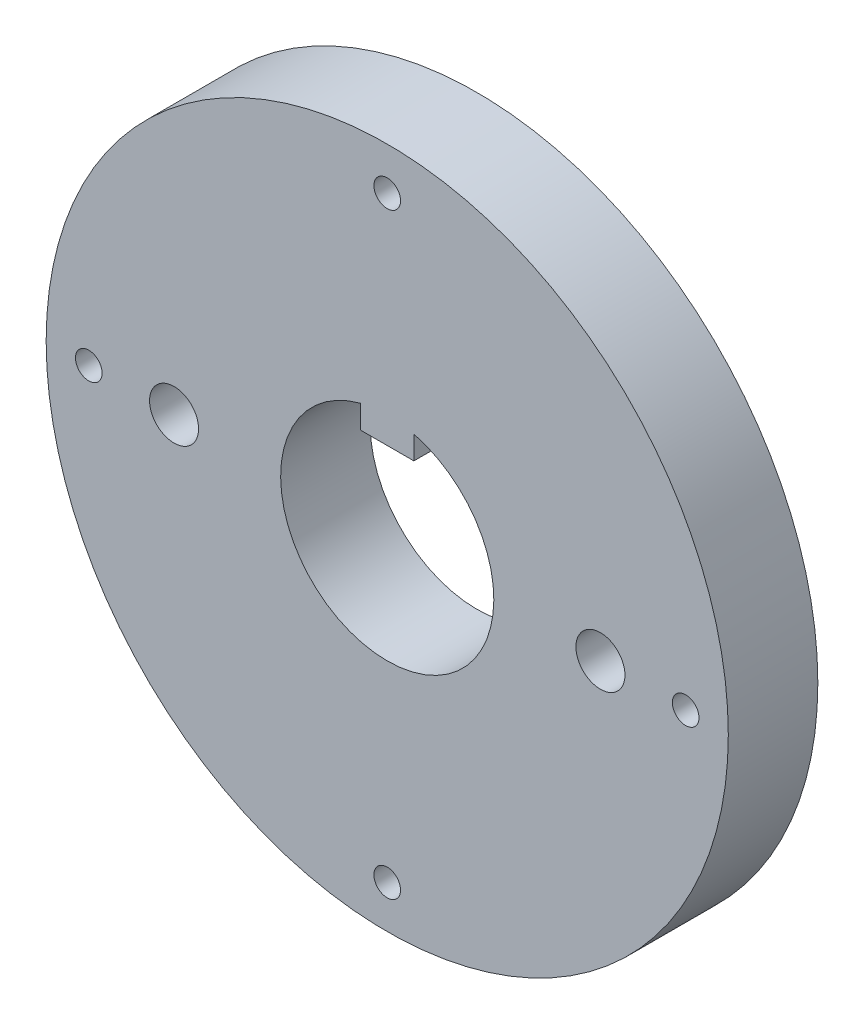
from build123d import *

# Parameters (mm, degrees)
SKETCH1_R                       = 20.32
SKETCH1_R_2                     = 9.144
BOSS_EXTRUDE1_DEPTH             = 2.667
SKETCH2_R                       = 1.4605
CUT_EXTRUDE1_DEPTH              = 30.227664224
BOSS_EXTRUDE2_REACH             = 30.86
SKETCH3_R                       = 9.525
BOSS_EXTRUDE2_DIRECTION_2_REACH = 30.86
SKETCH4_R                       = 0.79375
CUT_EXTRUDE2_DEPTH              = 30.227664224


with BuildPart() as part:
    # Sketch1 → Boss-Extrude1 (new, symmetric)
    with BuildSketch(Plane.XY):
        Circle(SKETCH1_R)
        Circle(SKETCH1_R_2, mode=Mode.SUBTRACT)
    extrude(amount=BOSS_EXTRUDE1_DEPTH, both=True)

    # Sketch2 → Cut-Extrude1 (cut, through all)
    with BuildSketch(Plane.XY.offset(2.667)):
        with Locations((12.7, 0)):
            Circle(SKETCH2_R)
        with Locations((-12.7, 0)):
            Circle(SKETCH2_R)
    extrude(amount=-CUT_EXTRUDE1_DEPTH, mode=Mode.SUBTRACT)

    # Boss-Extrude2: up to this face of the body (flat: up to its plane)
    boss_extrude2_end = Plane(part.part.faces().sort_by_distance((-19.745263608, 0, 2.667))[0])
    # Sketch3 → Boss-Extrude2 (add, up to the picked face)
    with BuildSketch(Plane.XY, mode=Mode.PRIVATE) as boss_extrude2_sk1:
        Circle(SKETCH3_R)
        with BuildLine():
            Line((-1.5875, 6.148361062), (-1.5875, 4.7625))
            Line((-1.5875, 4.7625), (1.5875, 4.7625))
            Line((1.5875, 4.7625), (1.5875, 6.148361062))
            ThreePointArc((1.5875, 6.148361062), (0, -6.35), (-1.5875, 6.148361062))
        make_face(mode=Mode.SUBTRACT)
    boss_extrude2_tool1 = split(extrude(boss_extrude2_sk1.sketch, amount=BOSS_EXTRUDE2_REACH, mode=Mode.PRIVATE), bisect_by=boss_extrude2_end, keep=Keep.BOTH, mode=Mode.PRIVATE)
    add(boss_extrude2_tool1.solids().sort_by(Axis((-9.255592, 0, 0), (0, 0, 1)))[0])

    # Boss-Extrude2 direction 2: up to this face of the body (flat: up to its plane)
    boss_extrude2_direction_2_end = Plane(part.part.faces().sort_by_distance((-19.745263608, 0, -2.667))[0])
    # Sketch3 → Boss-Extrude2 direction 2 (add, up to the picked face)
    with BuildSketch(Plane.XY, mode=Mode.PRIVATE) as boss_extrude2_direction_2_sk1:
        Circle(SKETCH3_R)
        with BuildLine():
            Line((-1.5875, 6.148361062), (-1.5875, 4.7625))
            Line((-1.5875, 4.7625), (1.5875, 4.7625))
            Line((1.5875, 4.7625), (1.5875, 6.148361062))
            ThreePointArc((1.5875, 6.148361062), (0, -6.35), (-1.5875, 6.148361062))
        make_face(mode=Mode.SUBTRACT)
    boss_extrude2_direction_2_tool1 = split(extrude(boss_extrude2_direction_2_sk1.sketch, amount=-BOSS_EXTRUDE2_DIRECTION_2_REACH, mode=Mode.PRIVATE), bisect_by=boss_extrude2_direction_2_end, keep=Keep.BOTH, mode=Mode.PRIVATE)
    add(boss_extrude2_direction_2_tool1.solids().sort_by(Axis((-9.255592, 0, 0), (0, 0, -1)))[0])

    # Sketch4 → Cut-Extrude2 (cut, through all)
    with BuildSketch(Plane.XY.offset(2.667)):
        with Locations((0, 17.78)):
            Circle(SKETCH4_R)
        with Locations((17.78, 0)):
            Circle(SKETCH4_R)
        with Locations((0, -17.78)):
            Circle(SKETCH4_R)
        with Locations((-17.78, 0)):
            Circle(SKETCH4_R)
    extrude(amount=-CUT_EXTRUDE2_DEPTH, mode=Mode.SUBTRACT)


solid = part.part
